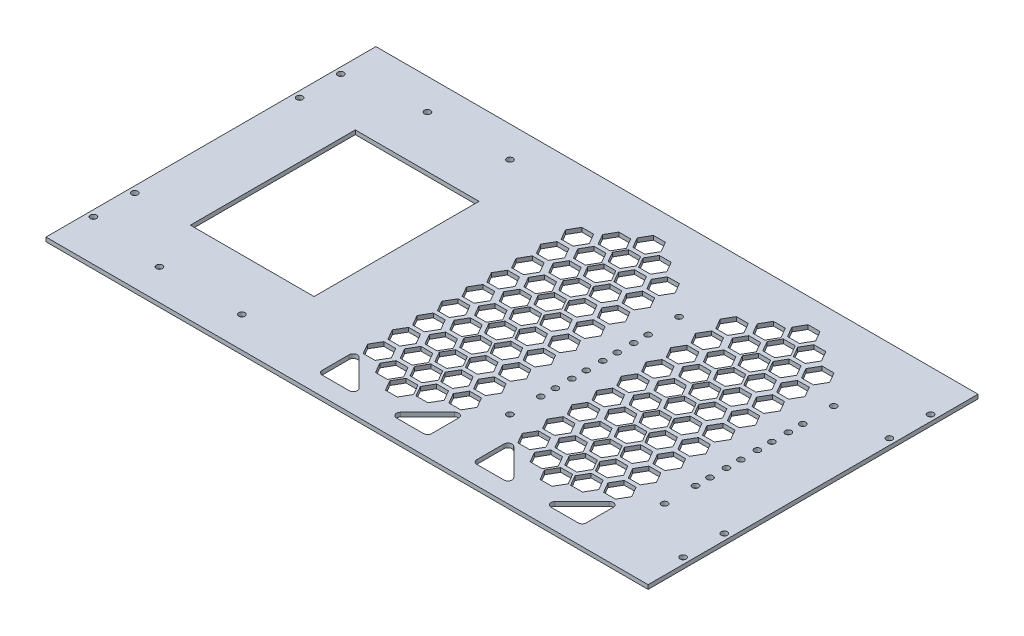
from build123d import *

# Parameters (mm, degrees)
SKETCH_1_W          = 292
SKETCH_1_H          = 160
SKETCH_1_R          = 1.5
SKETCH_1_W_2        = 60
SKETCH_1_H_2        = 80
EXTRUDE_1_DEPTH     = 2
SKETCH_2_W          = 73.182681186
SKETCH_2_H          = 121.719048407
SKETCH_2_W_2        = 69.030910006
SKETCH_2_H_2        = 105.373653802
EXTRUDE_2_DEPTH     = 2
CUT_EXTRUDE_1_DEPTH = 10


with BuildPart() as part:
    # 草图1 → 凸台-拉伸1 (new body)
    with BuildSketch(Plane(origin=(0, 0, 0), x_dir=(1, 0, 0), z_dir=(0, 1, 0))):
        with Locations((146, 80)):
            Rectangle(SKETCH_1_W, SKETCH_1_H)
        with Locations(Location((3, 140, 0), (0, 0, 270))):
            Circle(SKETCH_1_R, mode=Mode.SUBTRACT)
        with Locations(Location((3, 120, 0), (0, 0, 270))):
            Circle(SKETCH_1_R, mode=Mode.SUBTRACT)
        with Locations(Location((3, 40, 0), (0, 0, 270))):
            Circle(SKETCH_1_R, mode=Mode.SUBTRACT)
        with Locations(Location((3, 20, 0), (0, 0, 270))):
            Circle(SKETCH_1_R, mode=Mode.SUBTRACT)
        with Locations(Location((289, 20, 0), (0, 0, 90))):
            Circle(SKETCH_1_R, mode=Mode.SUBTRACT)
        with Locations(Location((289, 40, 0), (0, 0, 90))):
            Circle(SKETCH_1_R, mode=Mode.SUBTRACT)
        with Locations(Location((289, 120, 0), (0, 0, 90))):
            Circle(SKETCH_1_R, mode=Mode.SUBTRACT)
        with Locations(Location((289, 140, 0), (0, 0, 90))):
            Circle(SKETCH_1_R, mode=Mode.SUBTRACT)
        with Locations(Location((187, 120, 0), (0, 0, 270))):
            Circle(SKETCH_1_R, mode=Mode.SUBTRACT)
        with Locations(Location((262, 120, 0), (0, 0, 270))):
            Circle(SKETCH_1_R, mode=Mode.SUBTRACT)
        with Locations(Location((262, 98, 0), (0, 0, 270))):
            Circle(SKETCH_1_R, mode=Mode.SUBTRACT)
        with Locations(Location((187, 98, 0), (0, 0, 270))):
            Circle(SKETCH_1_R, mode=Mode.SUBTRACT)
        with Locations(Location((187, 105, 0), (0, 0, 270))):
            Circle(SKETCH_1_R, mode=Mode.SUBTRACT)
        with Locations(Location((262, 105, 0), (0, 0, 270))):
            Circle(SKETCH_1_R, mode=Mode.SUBTRACT)
        with Locations(Location((187, 83, 0), (0, 0, 270))):
            Circle(SKETCH_1_R, mode=Mode.SUBTRACT)
        with Locations(Location((262, 83, 0), (0, 0, 270))):
            Circle(SKETCH_1_R, mode=Mode.SUBTRACT)
        with Locations(Location((187, 90, 0), (0, 0, 270))):
            Circle(SKETCH_1_R, mode=Mode.SUBTRACT)
        with Locations(Location((262, 90, 0), (0, 0, 270))):
            Circle(SKETCH_1_R, mode=Mode.SUBTRACT)
        with Locations(Location((187, 68, 0), (0, 0, 270))):
            Circle(SKETCH_1_R, mode=Mode.SUBTRACT)
        with Locations(Location((262, 68, 0), (0, 0, 270))):
            Circle(SKETCH_1_R, mode=Mode.SUBTRACT)
        with Locations(Location((187, 75, 0), (0, 0, 270))):
            Circle(SKETCH_1_R, mode=Mode.SUBTRACT)
        with Locations(Location((262, 75, 0), (0, 0, 270))):
            Circle(SKETCH_1_R, mode=Mode.SUBTRACT)
        with Locations(Location((187, 53, 0), (0, 0, 270))):
            Circle(SKETCH_1_R, mode=Mode.SUBTRACT)
        with Locations(Location((262, 53, 0), (0, 0, 270))):
            Circle(SKETCH_1_R, mode=Mode.SUBTRACT)
        with Locations(Location((187, 60, 0), (0, 0, 270))):
            Circle(SKETCH_1_R, mode=Mode.SUBTRACT)
        with Locations(Location((262, 60, 0), (0, 0, 270))):
            Circle(SKETCH_1_R, mode=Mode.SUBTRACT)
        with Locations(Location((187, 38, 0), (0, 0, 270))):
            Circle(SKETCH_1_R, mode=Mode.SUBTRACT)
        with Locations(Location((262, 38, 0), (0, 0, 270))):
            Circle(SKETCH_1_R, mode=Mode.SUBTRACT)
        with Locations(Location((40, 145, 0), (0, 0, 270))):
            Circle(SKETCH_1_R, mode=Mode.SUBTRACT)
        with Locations(Location((80, 145, 0), (0, 0, 270))):
            Circle(SKETCH_1_R, mode=Mode.SUBTRACT)
        with Locations(Location((40, 15, 0), (0, 0, 270))):
            Circle(SKETCH_1_R, mode=Mode.SUBTRACT)
        with Locations(Location((80, 15, 0), (0, 0, 270))):
            Circle(SKETCH_1_R, mode=Mode.SUBTRACT)
        with Locations((60, 80)):
            Rectangle(SKETCH_1_W_2, SKETCH_1_H_2, mode=Mode.SUBTRACT)
        with BuildLine():
            Line((197, 124), (252, 124))
            ThreePointArc((252, 124), (256, 120), (252, 116))
            Line((252, 116), (197, 116))
            ThreePointArc((197, 116), (193, 120), (197, 124))
        make_face(mode=Mode.SUBTRACT)
        with BuildLine():
            Line((197, 101), (252, 101))
            ThreePointArc((252, 101), (256, 105), (252, 109))
            Line((252, 109), (197, 109))
            ThreePointArc((197, 109), (193, 105), (197, 101))
        make_face(mode=Mode.SUBTRACT)
        with BuildLine():
            Line((197, 86), (252, 86))
            ThreePointArc((252, 86), (256, 90), (252, 94))
            Line((252, 94), (197, 94))
            ThreePointArc((197, 94), (193, 90), (197, 86))
        make_face(mode=Mode.SUBTRACT)
        with BuildLine():
            Line((197, 71), (252, 71))
            ThreePointArc((252, 71), (256, 75), (252, 79))
            Line((252, 79), (197, 79))
            ThreePointArc((197, 79), (193, 75), (197, 71))
        make_face(mode=Mode.SUBTRACT)
        with BuildLine():
            Line((197, 56), (252, 56))
            ThreePointArc((252, 56), (256, 60), (252, 64))
            Line((252, 64), (197, 64))
            ThreePointArc((197, 64), (193, 60), (197, 56))
        make_face(mode=Mode.SUBTRACT)
        with BuildLine():
            Line((197, 49), (252, 49))
            ThreePointArc((252, 49), (256, 45), (252, 41))
            Line((252, 41), (197, 41))
            ThreePointArc((197, 41), (193, 45), (197, 49))
        make_face(mode=Mode.SUBTRACT)
        with BuildLine():
            Line((197, 34), (252, 34))
            ThreePointArc((252, 34), (256, 30), (252, 26))
            Line((252, 26), (197, 26))
            ThreePointArc((197, 26), (193, 30), (197, 34))
        make_face(mode=Mode.SUBTRACT)
        with BuildLine():
            Line((118.5, 116), (173.5, 116))
            ThreePointArc((173.5, 116), (177.5, 120), (173.5, 124))
            Line((173.5, 124), (118.5, 124))
            ThreePointArc((118.5, 124), (114.5, 120), (118.5, 116))
        make_face(mode=Mode.SUBTRACT)
        with BuildLine():
            Line((118.5, 109), (173.5, 109))
            ThreePointArc((173.5, 109), (177.5, 105), (173.5, 101))
            Line((173.5, 101), (118.5, 101))
            ThreePointArc((118.5, 101), (114.5, 105), (118.5, 109))
        make_face(mode=Mode.SUBTRACT)
        with BuildLine():
            Line((118.5, 94), (173.5, 94))
            ThreePointArc((173.5, 94), (177.5, 90), (173.5, 86))
            Line((173.5, 86), (118.5, 86))
            ThreePointArc((118.5, 86), (114.5, 90), (118.5, 94))
        make_face(mode=Mode.SUBTRACT)
        with BuildLine():
            Line((118.5, 79), (173.5, 79))
            ThreePointArc((173.5, 79), (177.5, 75), (173.5, 71))
            Line((173.5, 71), (118.5, 71))
            ThreePointArc((118.5, 71), (114.5, 75), (118.5, 79))
        make_face(mode=Mode.SUBTRACT)
        with BuildLine():
            Line((118.5, 64), (173.5, 64))
            ThreePointArc((173.5, 64), (177.5, 60), (173.5, 56))
            Line((173.5, 56), (118.5, 56))
            ThreePointArc((118.5, 56), (114.5, 60), (118.5, 64))
        make_face(mode=Mode.SUBTRACT)
        with BuildLine():
            Line((118.5, 49), (173.5, 49))
            ThreePointArc((173.5, 49), (177.5, 45), (173.5, 41))
            Line((173.5, 41), (118.5, 41))
            ThreePointArc((118.5, 41), (114.5, 45), (118.5, 49))
        make_face(mode=Mode.SUBTRACT)
        with BuildLine():
            Line((118.5, 34), (173.5, 34))
            ThreePointArc((173.5, 34), (177.5, 30), (173.5, 26))
            Line((173.5, 26), (118.5, 26))
            ThreePointArc((118.5, 26), (114.5, 30), (118.5, 34))
        make_face(mode=Mode.SUBTRACT)
    extrude(amount=EXTRUDE_1_DEPTH)

    # 草图2 → 凸台-拉伸2 (add)
    with BuildSketch(Plane(origin=(0, 2, 0), x_dir=(1, 0, 0), z_dir=(0, 1, 0))):
        with Locations((143.915863426, 79.705280754)):
            Rectangle(SKETCH_2_W, SKETCH_2_H)
        with Locations((224.823746786, 75.944406039)):
            Rectangle(SKETCH_2_W_2, SKETCH_2_H_2)
    extrude(amount=-EXTRUDE_2_DEPTH)

    # 草图3 → 切除-拉伸1 (cut)
    with BuildSketch(Plane(origin=(0, 2, 0), x_dir=(1, 0, 0), z_dir=(0, 1, 0))):
        Polygon((230.273502692, 143), (227.386751346, 148), (221.613248654, 148), (218.726497308, 143), (221.613248654, 138), (227.386751346, 138), align=None)
        Polygon((240.088457268, 136), (237.201705922, 141), (231.42820323, 141), (228.541451884, 136), (231.42820323, 131), (237.201705922, 131), align=None)
        Polygon((211.798294078, 131), (208.911542732, 136), (211.798294078, 141), (217.57179677, 141), (220.458548116, 136), (217.57179677, 131), align=None)
        Polygon((230.273502692, 131), (227.386751346, 136), (221.613248654, 136), (218.726497308, 131), (221.613248654, 126), (227.386751346, 126), align=None)
        Polygon((211.798294078, 119), (208.911542732, 124), (211.798294078, 129), (217.57179677, 129), (220.458548116, 124), (217.57179677, 119), align=None)
        Polygon((240.088457268, 124), (237.201705922, 129), (231.42820323, 129), (228.541451884, 124), (231.42820323, 119), (237.201705922, 119), align=None)
        Polygon((230.273502692, 119), (227.386751346, 124), (221.613248654, 124), (218.726497308, 119), (221.613248654, 114), (227.386751346, 114), align=None)
        Polygon((211.798294078, 107), (208.911542732, 112), (211.798294078, 117), (217.57179677, 117), (220.458548116, 112), (217.57179677, 107), align=None)
        Polygon((240.088457268, 112), (237.201705922, 117), (231.42820323, 117), (228.541451884, 112), (231.42820323, 107), (237.201705922, 107), align=None)
        Polygon((230.273502692, 107), (227.386751346, 112), (221.613248654, 112), (218.726497308, 107), (221.613248654, 102), (227.386751346, 102), align=None)
        Polygon((211.798294078, 95), (208.911542732, 100), (211.798294078, 105), (217.57179677, 105), (220.458548116, 100), (217.57179677, 95), align=None)
        Polygon((240.088457268, 100), (237.201705922, 105), (231.42820323, 105), (228.541451884, 100), (231.42820323, 95), (237.201705922, 95), align=None)
        Polygon((230.273502692, 95), (227.386751346, 100), (221.613248654, 100), (218.726497308, 95), (221.613248654, 90), (227.386751346, 90), align=None)
        Polygon((211.798294078, 83), (208.911542732, 88), (211.798294078, 93), (217.57179677, 93), (220.458548116, 88), (217.57179677, 83), align=None)
        Polygon((240.088457268, 88), (237.201705922, 93), (231.42820323, 93), (228.541451884, 88), (231.42820323, 83), (237.201705922, 83), align=None)
        Polygon((230.273502692, 83), (227.386751346, 88), (221.613248654, 88), (218.726497308, 83), (221.613248654, 78), (227.386751346, 78), align=None)
        Polygon((211.798294078, 71), (208.911542732, 76), (211.798294078, 81), (217.57179677, 81), (220.458548116, 76), (217.57179677, 71), align=None)
        Polygon((240.088457268, 76), (237.201705922, 81), (231.42820323, 81), (228.541451884, 76), (231.42820323, 71), (237.201705922, 71), align=None)
        Polygon((230.273502692, 71), (227.386751346, 76), (221.613248654, 76), (218.726497308, 71), (221.613248654, 66), (227.386751346, 66), align=None)
        Polygon((211.798294078, 59), (208.911542732, 64), (211.798294078, 69), (217.57179677, 69), (220.458548116, 64), (217.57179677, 59), align=None)
        Polygon((240.088457268, 64), (237.201705922, 69), (231.42820323, 69), (228.541451884, 64), (231.42820323, 59), (237.201705922, 59), align=None)
        Polygon((230.273502692, 59), (227.386751346, 64), (221.613248654, 64), (218.726497308, 59), (221.613248654, 54), (227.386751346, 54), align=None)
        Polygon((211.798294078, 47), (208.911542732, 52), (211.798294078, 57), (217.57179677, 57), (220.458548116, 52), (217.57179677, 47), align=None)
        Polygon((240.088457268, 52), (237.201705922, 57), (231.42820323, 57), (228.541451884, 52), (231.42820323, 47), (237.201705922, 47), align=None)
        Polygon((230.273502692, 47), (227.386751346, 52), (221.613248654, 52), (218.726497308, 47), (221.613248654, 42), (227.386751346, 42), align=None)
        Polygon((211.798294078, 35), (208.911542732, 40), (211.798294078, 45), (217.57179677, 45), (220.458548116, 40), (217.57179677, 35), align=None)
        Polygon((240.088457268, 40), (237.201705922, 45), (231.42820323, 45), (228.541451884, 40), (231.42820323, 35), (237.201705922, 35), align=None)
        Polygon((230.273502692, 35), (227.386751346, 40), (221.613248654, 40), (218.726497308, 35), (221.613248654, 30), (227.386751346, 30), align=None)
        Polygon((211.798294078, 23), (208.911542732, 28), (211.798294078, 33), (217.57179677, 33), (220.458548116, 28), (217.57179677, 23), align=None)
        Polygon((240.088457268, 28), (237.201705922, 33), (231.42820323, 33), (228.541451884, 28), (231.42820323, 23), (237.201705922, 23), align=None)
        Polygon((242.397858345, 124), (239.511106999, 129), (242.397858345, 134), (248.171361037, 134), (251.058112383, 129), (248.171361037, 124), align=None)
        Polygon((209.488893001, 129), (206.602141655, 134), (200.828638963, 134), (197.941887617, 129), (200.828638963, 124), (206.602141655, 124), align=None)
        Polygon((209.488893001, 117), (206.602141655, 122), (200.828638963, 122), (197.941887617, 117), (200.828638963, 112), (206.602141655, 112), align=None)
        Polygon((242.397858345, 112), (239.511106999, 117), (242.397858345, 122), (248.171361037, 122), (251.058112383, 117), (248.171361037, 112), align=None)
        Polygon((209.488893001, 105), (206.602141655, 110), (200.828638963, 110), (197.941887617, 105), (200.828638963, 100), (206.602141655, 100), align=None)
        Polygon((242.397858345, 100), (239.511106999, 105), (242.397858345, 110), (248.171361037, 110), (251.058112383, 105), (248.171361037, 100), align=None)
        Polygon((209.488893001, 93), (206.602141655, 98), (200.828638963, 98), (197.941887617, 93), (200.828638963, 88), (206.602141655, 88), align=None)
        Polygon((242.397858345, 88), (239.511106999, 93), (242.397858345, 98), (248.171361037, 98), (251.058112383, 93), (248.171361037, 88), align=None)
        Polygon((209.488893001, 81), (206.602141655, 86), (200.828638963, 86), (197.941887617, 81), (200.828638963, 76), (206.602141655, 76), align=None)
        Polygon((242.397858345, 76), (239.511106999, 81), (242.397858345, 86), (248.171361037, 86), (251.058112383, 81), (248.171361037, 76), align=None)
        Polygon((209.488893001, 69), (206.602141655, 74), (200.828638963, 74), (197.941887617, 69), (200.828638963, 64), (206.602141655, 64), align=None)
        Polygon((242.397858345, 64), (239.511106999, 69), (242.397858345, 74), (248.171361037, 74), (251.058112383, 69), (248.171361037, 64), align=None)
        Polygon((209.488893001, 57), (206.602141655, 62), (200.828638963, 62), (197.941887617, 57), (200.828638963, 52), (206.602141655, 52), align=None)
        Polygon((242.397858345, 52), (239.511106999, 57), (242.397858345, 62), (248.171361037, 62), (251.058112383, 57), (248.171361037, 52), align=None)
        Polygon((209.488893001, 45), (206.602141655, 50), (200.828638963, 50), (197.941887617, 45), (200.828638963, 40), (206.602141655, 40), align=None)
        Polygon((242.397858345, 40), (239.511106999, 45), (242.397858345, 50), (248.171361037, 50), (251.058112383, 45), (248.171361037, 40), align=None)
        Polygon((209.488893001, 33), (206.602141655, 38), (200.828638963, 38), (197.941887617, 33), (200.828638963, 28), (206.602141655, 28), align=None)
        Polygon((242.397858345, 28), (239.511106999, 33), (242.397858345, 38), (248.171361037, 38), (251.058112383, 33), (248.171361037, 28), align=None)
        Polygon((230.273502692, 23), (227.386751346, 28), (221.613248654, 28), (218.726497308, 23), (221.613248654, 18), (227.386751346, 18), align=None)
        Polygon((146.613248654, 18), (143.726497308, 23), (146.613248654, 28), (152.386751346, 28), (155.273502692, 23), (152.386751346, 18), align=None)
        Polygon((125.828638963, 28), (131.602141655, 28), (134.488893001, 33), (131.602141655, 38), (125.828638963, 38), (122.941887617, 33), align=None)
        Polygon((167.397858345, 28), (164.511106999, 33), (167.397858345, 38), (173.171361037, 38), (176.058112383, 33), (173.171361037, 28), align=None)
        Polygon((125.828638963, 40), (131.602141655, 40), (134.488893001, 45), (131.602141655, 50), (125.828638963, 50), (122.941887617, 45), align=None)
        Polygon((167.397858345, 40), (164.511106999, 45), (167.397858345, 50), (173.171361037, 50), (176.058112383, 45), (173.171361037, 40), align=None)
        Polygon((125.828638963, 52), (131.602141655, 52), (134.488893001, 57), (131.602141655, 62), (125.828638963, 62), (122.941887617, 57), align=None)
        Polygon((167.397858345, 52), (164.511106999, 57), (167.397858345, 62), (173.171361037, 62), (176.058112383, 57), (173.171361037, 52), align=None)
        Polygon((125.828638963, 64), (131.602141655, 64), (134.488893001, 69), (131.602141655, 74), (125.828638963, 74), (122.941887617, 69), align=None)
        Polygon((167.397858345, 64), (164.511106999, 69), (167.397858345, 74), (173.171361037, 74), (176.058112383, 69), (173.171361037, 64), align=None)
        Polygon((125.828638963, 76), (131.602141655, 76), (134.488893001, 81), (131.602141655, 86), (125.828638963, 86), (122.941887617, 81), align=None)
        Polygon((167.397858345, 76), (164.511106999, 81), (167.397858345, 86), (173.171361037, 86), (176.058112383, 81), (173.171361037, 76), align=None)
        Polygon((125.828638963, 88), (131.602141655, 88), (134.488893001, 93), (131.602141655, 98), (125.828638963, 98), (122.941887617, 93), align=None)
        Polygon((167.397858345, 88), (164.511106999, 93), (167.397858345, 98), (173.171361037, 98), (176.058112383, 93), (173.171361037, 88), align=None)
        Polygon((125.828638963, 100), (131.602141655, 100), (134.488893001, 105), (131.602141655, 110), (125.828638963, 110), (122.941887617, 105), align=None)
        Polygon((167.397858345, 100), (164.511106999, 105), (167.397858345, 110), (173.171361037, 110), (176.058112383, 105), (173.171361037, 100), align=None)
        Polygon((125.828638963, 112), (131.602141655, 112), (134.488893001, 117), (131.602141655, 122), (125.828638963, 122), (122.941887617, 117), align=None)
        Polygon((167.397858345, 112), (164.511106999, 117), (167.397858345, 122), (173.171361037, 122), (176.058112383, 117), (173.171361037, 112), align=None)
        Polygon((134.488893001, 129), (131.602141655, 134), (125.828638963, 134), (122.941887617, 129), (125.828638963, 124), (131.602141655, 124), align=None)
        Polygon((167.397858345, 124), (164.511106999, 129), (167.397858345, 134), (173.171361037, 134), (176.058112383, 129), (173.171361037, 124), align=None)
        Polygon((136.798294078, 23), (133.911542732, 28), (136.798294078, 33), (142.57179677, 33), (145.458548116, 28), (142.57179677, 23), align=None)
        Polygon((156.42820323, 23), (162.201705922, 23), (165.088457268, 28), (162.201705922, 33), (156.42820323, 33), (153.541451884, 28), align=None)
        Polygon((146.613248654, 30), (143.726497308, 35), (146.613248654, 40), (152.386751346, 40), (155.273502692, 35), (152.386751346, 30), align=None)
        Polygon((136.798294078, 35), (133.911542732, 40), (136.798294078, 45), (142.57179677, 45), (145.458548116, 40), (142.57179677, 35), align=None)
        Polygon((156.42820323, 35), (162.201705922, 35), (165.088457268, 40), (162.201705922, 45), (156.42820323, 45), (153.541451884, 40), align=None)
        Polygon((146.613248654, 42), (143.726497308, 47), (146.613248654, 52), (152.386751346, 52), (155.273502692, 47), (152.386751346, 42), align=None)
        Polygon((136.798294078, 47), (133.911542732, 52), (136.798294078, 57), (142.57179677, 57), (145.458548116, 52), (142.57179677, 47), align=None)
        Polygon((156.42820323, 47), (162.201705922, 47), (165.088457268, 52), (162.201705922, 57), (156.42820323, 57), (153.541451884, 52), align=None)
        Polygon((146.613248654, 54), (143.726497308, 59), (146.613248654, 64), (152.386751346, 64), (155.273502692, 59), (152.386751346, 54), align=None)
        Polygon((136.798294078, 59), (133.911542732, 64), (136.798294078, 69), (142.57179677, 69), (145.458548116, 64), (142.57179677, 59), align=None)
        Polygon((156.42820323, 59), (162.201705922, 59), (165.088457268, 64), (162.201705922, 69), (156.42820323, 69), (153.541451884, 64), align=None)
        Polygon((146.613248654, 66), (143.726497308, 71), (146.613248654, 76), (152.386751346, 76), (155.273502692, 71), (152.386751346, 66), align=None)
        Polygon((136.798294078, 71), (133.911542732, 76), (136.798294078, 81), (142.57179677, 81), (145.458548116, 76), (142.57179677, 71), align=None)
        Polygon((156.42820323, 71), (162.201705922, 71), (165.088457268, 76), (162.201705922, 81), (156.42820323, 81), (153.541451884, 76), align=None)
        Polygon((146.613248654, 78), (143.726497308, 83), (146.613248654, 88), (152.386751346, 88), (155.273502692, 83), (152.386751346, 78), align=None)
        Polygon((136.798294078, 83), (133.911542732, 88), (136.798294078, 93), (142.57179677, 93), (145.458548116, 88), (142.57179677, 83), align=None)
        Polygon((156.42820323, 83), (162.201705922, 83), (165.088457268, 88), (162.201705922, 93), (156.42820323, 93), (153.541451884, 88), align=None)
        Polygon((146.613248654, 90), (143.726497308, 95), (146.613248654, 100), (152.386751346, 100), (155.273502692, 95), (152.386751346, 90), align=None)
        Polygon((136.798294078, 95), (133.911542732, 100), (136.798294078, 105), (142.57179677, 105), (145.458548116, 100), (142.57179677, 95), align=None)
        Polygon((156.42820323, 95), (162.201705922, 95), (165.088457268, 100), (162.201705922, 105), (156.42820323, 105), (153.541451884, 100), align=None)
        Polygon((146.613248654, 102), (143.726497308, 107), (146.613248654, 112), (152.386751346, 112), (155.273502692, 107), (152.386751346, 102), align=None)
        Polygon((136.798294078, 107), (133.911542732, 112), (136.798294078, 117), (142.57179677, 117), (145.458548116, 112), (142.57179677, 107), align=None)
        Polygon((156.42820323, 107), (162.201705922, 107), (165.088457268, 112), (162.201705922, 117), (156.42820323, 117), (153.541451884, 112), align=None)
        Polygon((146.613248654, 114), (143.726497308, 119), (146.613248654, 124), (152.386751346, 124), (155.273502692, 119), (152.386751346, 114), align=None)
        Polygon((136.798294078, 119), (133.911542732, 124), (136.798294078, 129), (142.57179677, 129), (145.458548116, 124), (142.57179677, 119), align=None)
        Polygon((156.42820323, 119), (162.201705922, 119), (165.088457268, 124), (162.201705922, 129), (156.42820323, 129), (153.541451884, 124), align=None)
        Polygon((146.613248654, 126), (143.726497308, 131), (146.613248654, 136), (152.386751346, 136), (155.273502692, 131), (152.386751346, 126), align=None)
        Polygon((165.088457268, 136), (162.201705922, 141), (156.42820323, 141), (153.541451884, 136), (156.42820323, 131), (162.201705922, 131), align=None)
        Polygon((136.798294078, 131), (133.911542732, 136), (136.798294078, 141), (142.57179677, 141), (145.458548116, 136), (142.57179677, 131), align=None)
        Polygon((146.613248654, 138), (143.726497308, 143), (146.613248654, 148), (152.386751346, 148), (155.273502692, 143), (152.386751346, 138), align=None)
        with BuildLine():
            Line((172.64389882, 25.5), (159.558112383, 12.414213562))
            ThreePointArc((159.558112383, 12.414213562), (159.12456688, 10.234633135), (160.972325945, 9))
            Line((160.972325945, 9), (174.058112383, 9))
            ThreePointArc((174.058112383, 9), (175.472325945, 9.585786438), (176.058112383, 11))
            Line((176.058112383, 11), (176.058112383, 24.085786438))
            ThreePointArc((176.058112383, 24.085786438), (174.823479247, 25.933545503), (172.64389882, 25.5))
        make_face()
        with BuildLine():
            Line((213.027674055, 9), (199.941887617, 9))
            ThreePointArc((199.941887617, 9), (198.527674055, 9.585786438), (197.941887617, 11))
            Line((197.941887617, 11), (197.941887617, 24.085786438))
            ThreePointArc((197.941887617, 24.085786438), (199.176520753, 25.933545503), (201.35610118, 25.5))
            Line((201.35610118, 25.5), (214.441887617, 12.414213562))
            ThreePointArc((214.441887617, 12.414213562), (214.87543312, 10.234633135), (213.027674055, 9))
        make_face()
        with BuildLine():
            Line((247.64389882, 25.5), (234.558112383, 12.414213562))
            ThreePointArc((234.558112383, 12.414213562), (234.12456688, 10.234633135), (235.972325945, 9))
            Line((235.972325945, 9), (249.058112383, 9))
            ThreePointArc((249.058112383, 9), (250.472325945, 9.585786438), (251.058112383, 11))
            Line((251.058112383, 11), (251.058112383, 24.085786438))
            ThreePointArc((251.058112383, 24.085786438), (249.823479247, 25.933545503), (247.64389882, 25.5))
        make_face()
        with BuildLine():
            Line((138.027674055, 9), (124.941887617, 9))
            ThreePointArc((124.941887617, 9), (123.527674055, 9.585786438), (122.941887617, 11))
            Line((122.941887617, 11), (122.941887617, 24.085786438))
            ThreePointArc((122.941887617, 24.085786438), (124.176520753, 25.933545503), (126.35610118, 25.5))
            Line((126.35610118, 25.5), (139.441887617, 12.414213562))
            ThreePointArc((139.441887617, 12.414213562), (139.87543312, 10.234633135), (138.027674055, 9))
        make_face()
    extrude(amount=-CUT_EXTRUDE_1_DEPTH, mode=Mode.SUBTRACT)


solid = part.part
